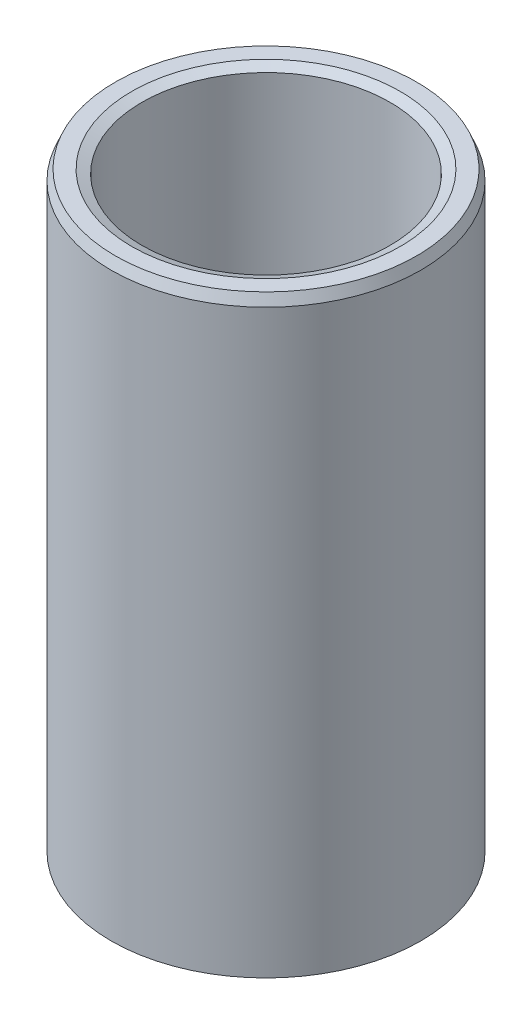
from build123d import *
from OCP.BRepFilletAPI import BRepFilletAPI_MakeChamfer

# Parameters (mm, degrees)
SKETCH1_R           = 52.5
BOSS_EXTRUDE1_DEPTH = 201.804179928
SKETCH2_R           = 42.049474241
CUT_EXTRUDE1_DEPTH  = 216.028898142
CHAMFER1_SIZE       = 3.47660898
CHAMFER1_SIZE2      = 1.44022366


with BuildPart() as part:
    # Sketch1 → Boss-Extrude1 (new body)
    with BuildSketch(Plane(origin=(0, 0, 0), x_dir=(1, 0, 0), z_dir=(0, 1, 0))):
        Circle(SKETCH1_R)
    extrude(amount=BOSS_EXTRUDE1_DEPTH)

    # Sketch2 → Cut-Extrude1 (cut, through all)
    with BuildSketch(Plane(origin=(0, 0, 0), x_dir=(1, 0, 0), z_dir=(0, 1, 0))):
        Circle(SKETCH2_R)
    extrude(amount=CUT_EXTRUDE1_DEPTH, mode=Mode.SUBTRACT)

    # Chamfer1: one chamfer whose edges measure the first distance from different faces: ONE call of the kernel's chamfer builder (chamfer() names one face for all edges)
    chamfer1_edges_1 = [part.edges().sort_by_distance(p)[0] for p in [
        (-42.049474241, 201.804179928, 0),
    ]]
    chamfer1_side_1 = [part.faces().sort_by_distance(p)[0] for p in [
        (-51.01507576, 201.804179928, 0),
    ]]
    chamfer1_edges_2 = [part.edges().sort_by_distance(p)[0] for p in [
        (-42.049474241, 0, 0),
    ]]
    chamfer1_side_2 = [part.faces().sort_by_distance(p)[0] for p in [
        (-42.049474241, 100.902089964, 0),
    ]]
    chamfer1_edges_3 = [part.edges().sort_by_distance(p)[0] for p in [
        (-52.5, 0, 0),
    ]]
    chamfer1_side_3 = [part.faces().sort_by_distance(p)[0] for p in [
        (-51.01507576, 0, 0),
    ]]
    chamfer1_edges_4 = [part.edges().sort_by_distance(p)[0] for p in [
        (-52.5, 201.804179928, 0),
    ]]
    chamfer1_side_4 = [part.faces().sort_by_distance(p)[0] for p in [
        (-52.5, 100.902089964, 0),
    ]]
    chamfer1 = BRepFilletAPI_MakeChamfer(part.part.solid().wrapped)
    for e in chamfer1_edges_1:
        chamfer1.Add(CHAMFER1_SIZE, CHAMFER1_SIZE2, e.wrapped, chamfer1_side_1[0].wrapped)  # the first distance lies on this face
    for e in chamfer1_edges_2:
        chamfer1.Add(CHAMFER1_SIZE, CHAMFER1_SIZE2, e.wrapped, chamfer1_side_2[0].wrapped)  # the first distance lies on this face
    for e in chamfer1_edges_3:
        chamfer1.Add(CHAMFER1_SIZE, CHAMFER1_SIZE2, e.wrapped, chamfer1_side_3[0].wrapped)  # the first distance lies on this face
    for e in chamfer1_edges_4:
        chamfer1.Add(CHAMFER1_SIZE, CHAMFER1_SIZE2, e.wrapped, chamfer1_side_4[0].wrapped)  # the first distance lies on this face
    add(Compound.cast(chamfer1.Shape()), mode=Mode.REPLACE)


solid = part.part
